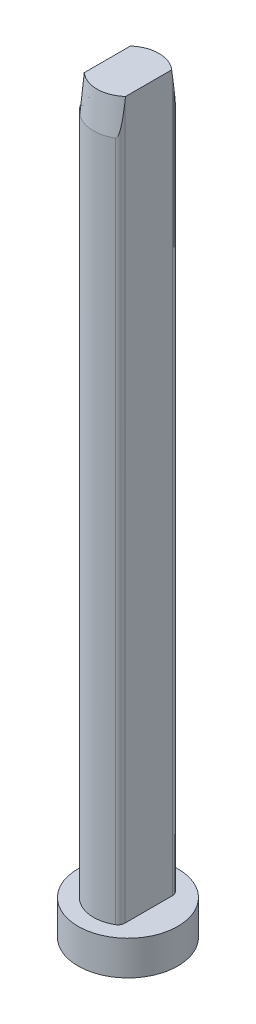
from build123d import *

# Parameters (mm, degrees)
CUT_EXTRUDE1_DEPTH = 5
CUT_EXTRUDE2_DEPTH = 99
FILLET1_R          = 1


with BuildPart() as part:
    # Sketch5 → Revolve1 (revolve)
    with BuildSketch(Plane.XY, mode=Mode.PRIVATE) as revolve1_sk:
        Polygon((0, 0), (7.25, 0), (7.25, 5), (5, 5), (5, 104), (4.5, 109), (0, 109), align=None)
    revolve(revolve1_sk.sketch.rotate(Axis((0, 109, 0), (0, -1, 0)), 180), axis=Axis((0, 109, 0), (0, -1, 0)))

    # Sketch6 → Cut-Extrude1 (cut)
    with BuildSketch(Plane(origin=(0, 109, 0), x_dir=(1, 0, 0), z_dir=(0, 1, 0))):
        with BuildLine():
            Line((3, 4), (3, -4))
            ThreePointArc((3, -4), (5, 0), (3, 4))
        make_face()
        with BuildLine():
            Line((-3, 4), (-3, -4))
            ThreePointArc((-3, -4), (-5, 0), (-3, 4))
        make_face()
    extrude(amount=-CUT_EXTRUDE1_DEPTH, mode=Mode.SUBTRACT)

    # Sketch7 → Cut-Extrude2 (cut)
    with BuildSketch(Plane(origin=(0, 104, 0), x_dir=(1, 0, 0), z_dir=(0, 1, 0))):
        with BuildLine():
            Line((3, -4), (3, 4))
            ThreePointArc((3, 4), (5, 0), (3, -4))
        make_face()
    extrude(amount=-CUT_EXTRUDE2_DEPTH, mode=Mode.SUBTRACT)

    # Fillet1
    # the kernel refuses this fillet: 1 mm, written as the material it takes off along each edge
    with BuildSketch(Plane(origin=(3, 108.493644566, 4), x_dir=(0, 0, -1), z_dir=(0, -1, 0))) as fillet1_piece_1:
        with BuildLine():
            CenterArc((0.535898385, -1), FILLET1_R, 90, 60)
            ThreePointArc((-0.330127019, -0.5), (-0.172559651, -0.245050643), (0, 0))
            Line((0, 0), (0.535898385, 0))
        make_face()
    extrude(amount=103.493644566, mode=Mode.SUBTRACT)
    with BuildSketch(Plane(origin=(3, 108.493644566, -4), x_dir=(0, 0, 1), z_dir=(0, -1, 0))) as fillet1_piece_2:
        with BuildLine():
            CenterArc((0.535898385, 1), FILLET1_R, 210, 60)
            ThreePointArc((-0.330127019, 0.5), (-0.172559651, 0.245050643), (0, 0))
            Line((0, 0), (0.535898385, 0))
        make_face()
    extrude(amount=103.493644566, mode=Mode.SUBTRACT)


solid = part.part
